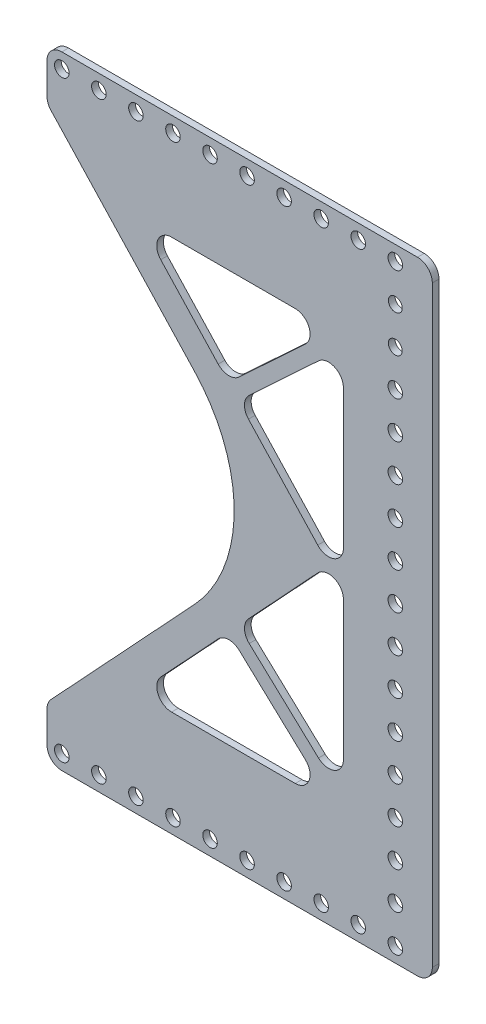
from build123d import *

# Parameters (mm, degrees)
SKETCH1_R           = 2.4892
SKETCH1_R_2         = 2.37186857
BOSS_EXTRUDE1_DEPTH = 2.286
CUT_EXTRUDE1_DEPTH  = 819.47149982
FILLET1_R           = 5.08


with BuildPart() as part:
    # Sketch1 → Boss-Extrude1 (new body)
    with BuildSketch(Plane.XY):
        with BuildLine():
            Line((238.806714439, 781.287169191), (222.296714439, 781.287169191))
            Line((222.296714439, 781.287169191), (176.576714439, 781.287169191))
            Line((176.576714439, 781.287169191), (116.886714439, 781.287169191))
            ThreePointArc((116.886714439, 781.287169191), (113.29461199, 779.799271639), (111.806714439, 776.207169191))
            Line((111.806714439, 776.207169191), (111.806714439, 757.885949725))
            ThreePointArc((111.806714439, 757.885949725), (112.159468576, 756.025964093), (113.16874064, 754.424292487))
            Line((113.16874064, 754.424292487), (162.347850631, 701.603741569))
            ThreePointArc((162.347850631, 701.603741569), (175.968112644, 666.987169191), (162.347850631, 632.370596813))
            Line((162.347850631, 632.370596813), (113.16874064, 579.550045895))
            ThreePointArc((113.16874064, 579.550045895), (112.159468576, 577.948374289), (111.806714439, 576.088388657))
            Line((111.806714439, 576.088388657), (111.806714439, 557.767169191))
            ThreePointArc((111.806714439, 557.767169191), (113.29461199, 554.175066742), (116.886714439, 552.687169191))
            Line((116.886714439, 552.687169191), (176.576714439, 552.687169191))
            Line((176.576714439, 552.687169191), (222.296714439, 552.687169191))
            Line((222.296714439, 552.687169191), (238.806714439, 552.687169191))
            ThreePointArc((238.806714439, 552.687169191), (242.398816887, 554.175066742), (243.886714439, 557.767169191))
            Line((243.886714439, 557.767169191), (243.886714439, 666.987169191))
            Line((243.886714439, 666.987169191), (243.886714439, 776.207169191))
            ThreePointArc((243.886714439, 776.207169191), (242.398816887, 779.799271639), (238.806714439, 781.287169191))
        make_face()
        with Locations((142.286714439, 768.587169191)):
            Circle(SKETCH1_R, mode=Mode.SUBTRACT)
        with Locations((154.986714439, 768.587169191)):
            Circle(SKETCH1_R, mode=Mode.SUBTRACT)
        with Locations((167.686714439, 768.587169191)):
            Circle(SKETCH1_R, mode=Mode.SUBTRACT)
        with Locations((231.186714439, 743.187169191)):
            Circle(SKETCH1_R_2, mode=Mode.SUBTRACT)
        with Locations((231.186714439, 730.487169191)):
            Circle(SKETCH1_R, mode=Mode.SUBTRACT)
        with Locations((231.186714439, 717.787169191)):
            Circle(SKETCH1_R, mode=Mode.SUBTRACT)
        with Locations((231.186714439, 705.087169191)):
            Circle(SKETCH1_R, mode=Mode.SUBTRACT)
        with Locations((231.186714439, 692.387169191)):
            Circle(SKETCH1_R, mode=Mode.SUBTRACT)
        with Locations((167.686714439, 565.387169191)):
            Circle(SKETCH1_R, mode=Mode.SUBTRACT)
        with Locations((154.986714439, 565.387169191)):
            Circle(SKETCH1_R, mode=Mode.SUBTRACT)
        with Locations((142.286714439, 565.387169191)):
            Circle(SKETCH1_R, mode=Mode.SUBTRACT)
        with Locations((231.186714439, 616.187169191)):
            Circle(SKETCH1_R, mode=Mode.SUBTRACT)
        with Locations((231.186714439, 603.487169191)):
            Circle(SKETCH1_R, mode=Mode.SUBTRACT)
        with Locations((231.186714439, 590.787169191)):
            Circle(SKETCH1_R, mode=Mode.SUBTRACT)
        with Locations((231.186714439, 565.387169191)):
            Circle(SKETCH1_R, mode=Mode.SUBTRACT)
        with Locations((231.186714439, 768.587169191)):
            Circle(SKETCH1_R, mode=Mode.SUBTRACT)
        with Locations((231.186714439, 654.287169191)):
            Circle(SKETCH1_R, mode=Mode.SUBTRACT)
        with Locations((231.186714439, 641.587169191)):
            Circle(SKETCH1_R, mode=Mode.SUBTRACT)
        with Locations((231.186714439, 628.887169191)):
            Circle(SKETCH1_R, mode=Mode.SUBTRACT)
        with Locations((116.886714439, 768.587169191)):
            Circle(SKETCH1_R, mode=Mode.SUBTRACT)
        with Locations((129.586714439, 768.587169191)):
            Circle(SKETCH1_R, mode=Mode.SUBTRACT)
        with Locations((129.586714439, 565.387169191)):
            Circle(SKETCH1_R, mode=Mode.SUBTRACT)
        with Locations((116.886714439, 565.387169191)):
            Circle(SKETCH1_R, mode=Mode.SUBTRACT)
        with Locations((231.186714439, 679.687169191)):
            Circle(SKETCH1_R, mode=Mode.SUBTRACT)
        with Locations((231.186714439, 666.987169191)):
            Circle(SKETCH1_R, mode=Mode.SUBTRACT)
        with Locations((231.186714439, 755.887169191)):
            Circle(SKETCH1_R_2, mode=Mode.SUBTRACT)
        with Locations((231.186714439, 578.087169191)):
            Circle(SKETCH1_R, mode=Mode.SUBTRACT)
        with Locations((180.386714439, 565.387169191)):
            Circle(SKETCH1_R, mode=Mode.SUBTRACT)
        with Locations((193.086714439, 565.387169191)):
            Circle(SKETCH1_R, mode=Mode.SUBTRACT)
        with Locations((205.786714439, 565.387169191)):
            Circle(SKETCH1_R, mode=Mode.SUBTRACT)
        with Locations((218.486714439, 565.387169191)):
            Circle(SKETCH1_R, mode=Mode.SUBTRACT)
        with Locations((180.386714439, 768.587169191)):
            Circle(SKETCH1_R, mode=Mode.SUBTRACT)
        with Locations((193.086714439, 768.587169191)):
            Circle(SKETCH1_R, mode=Mode.SUBTRACT)
        with Locations((205.786714439, 768.587169191)):
            Circle(SKETCH1_R, mode=Mode.SUBTRACT)
        with Locations((218.486714439, 768.587169191)):
            Circle(SKETCH1_R, mode=Mode.SUBTRACT)
        with BuildLine():
            Line((150.786953537, 728.930511953), (170.473797978, 707.785965632))
            ThreePointArc((170.473797978, 707.785965632), (174.010528598, 706.170857078), (177.653429014, 707.529649071))
            Line((177.653429014, 707.529649071), (200.363611972, 728.674195392))
            ThreePointArc((200.363611972, 728.674195392), (201.629200597, 734.252154823), (196.901954734, 737.472169191))
            Line((196.901954734, 737.472169191), (154.504927335, 737.472169191))
            ThreePointArc((154.504927335, 737.472169191), (149.847051276, 734.419628344), (150.786953537, 728.930511953))
        make_face(mode=Mode.SUBTRACT)
        with BuildLine():
            Line((213.406714439, 674.585176614), (213.406714439, 722.206352957))
            ThreePointArc((213.406714439, 722.206352957), (210.354173591, 726.864229016), (204.865057201, 725.924326755))
            Line((204.865057201, 725.924326755), (181.115086252, 703.811675273))
            ThreePointArc((181.115086252, 703.811675273), (179.499977697, 700.274944652), (180.858769691, 696.632044236))
            Line((180.858769691, 696.632044236), (204.60874064, 671.123519376))
            ThreePointArc((204.60874064, 671.123519376), (210.186700071, 669.857930751), (213.406714439, 674.585176614))
        make_face(mode=Mode.SUBTRACT)
        with BuildLine():
            Line((180.858769691, 637.342294146), (204.60874064, 662.850819006))
            ThreePointArc((204.60874064, 662.850819006), (210.186700071, 664.116407631), (213.406714439, 659.389161768))
            Line((213.406714439, 659.389161768), (213.406714439, 611.767985425))
            ThreePointArc((213.406714439, 611.767985425), (210.354173591, 607.110109366), (204.865057201, 608.050011626))
            Line((204.865057201, 608.050011626), (181.115086252, 630.162663109))
            ThreePointArc((181.115086252, 630.162663109), (179.499977697, 633.699393729), (180.858769691, 637.342294146))
        make_face(mode=Mode.SUBTRACT)
        with BuildLine():
            Line((200.363611972, 605.30014299), (177.653429014, 626.44468931))
            ThreePointArc((177.653429014, 626.44468931), (174.010528598, 627.803481304), (170.473797978, 626.188372749))
            Line((170.473797978, 626.188372749), (150.786953537, 605.043826429))
            ThreePointArc((150.786953537, 605.043826429), (149.847051276, 599.554710038), (154.504927335, 596.502169191))
            Line((154.504927335, 596.502169191), (196.901954734, 596.502169191))
            ThreePointArc((196.901954734, 596.502169191), (201.629200597, 599.722183559), (200.363611972, 605.30014299))
        make_face(mode=Mode.SUBTRACT)
    extrude(amount=BOSS_EXTRUDE1_DEPTH)

    # Sketch3 → Cut-Extrude1 (cut, through all)
    with BuildSketch(Plane.XY.offset(2.286)):
        with BuildLine():
            Line((111.806714439, 776.207169191), (111.806714439, 773.667169191))
            Line((111.806714439, 773.667169191), (243.886714439, 773.667169191))
            Line((243.886714439, 773.667169191), (243.886714439, 776.207169191))
            ThreePointArc((243.886714439, 776.207169191), (242.398816887, 779.799271639), (238.806714439, 781.287169191))
            Line((238.806714439, 781.287169191), (116.886714439, 781.287169191))
            ThreePointArc((116.886714439, 781.287169191), (113.29461199, 779.799271639), (111.806714439, 776.207169191))
        make_face()
        with BuildLine():
            Line((243.886714439, 557.767169191), (243.886714439, 560.307169191))
            Line((243.886714439, 560.307169191), (111.806714439, 560.307169191))
            Line((111.806714439, 560.307169191), (111.806714439, 557.767169191))
            ThreePointArc((111.806714439, 557.767169191), (113.29461199, 554.175066742), (116.886714439, 552.687169191))
            Line((116.886714439, 552.687169191), (238.806714439, 552.687169191))
            ThreePointArc((238.806714439, 552.687169191), (242.398816887, 554.175066742), (243.886714439, 557.767169191))
        make_face()
    extrude(amount=-CUT_EXTRUDE1_DEPTH, mode=Mode.SUBTRACT)

    # Fillet1
    fillet1_edges = [part.edges().sort_by_distance(p)[0] for p in [
        (243.886714439, 560.307169191, 1.143),
        (111.806714439, 560.307169191, 1.143),
        (243.886714439, 773.667169191, 1.143),
        (111.806714439, 773.667169191, 1.143),
    ]]
    fillet(fillet1_edges, radius=FILLET1_R)


solid = part.part
